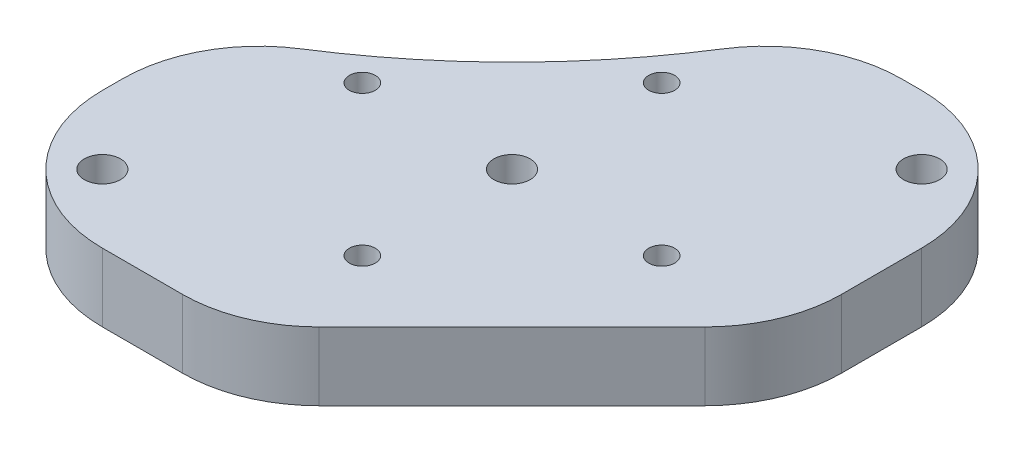
from build123d import *

# Parameters (mm, degrees)
EXTRUDE_4_OUTLINE_R   = 2.65
EXTRUDE_4_OUTLINE_R_2 = 1.9
EXTRUDE_4_DEPTH       = 10
FILLET_2_R            = 20


# Read off the part's stored shape, not the designer's step: 凸台-拉伸4
with BuildPart() as part:
    # 凸台-拉伸4 outline → 凸台-拉伸4 (new body)
    with BuildSketch(Plane(origin=(0, 0, 0), x_dir=(1, 0, 0), z_dir=(0, 1, 0))):
        with BuildLine():
            Line((85, -125), (125, -85))
            Line((125, -85), (125, -45))
            Line((125, -45), (90.421236444, -45))
            ThreePointArc((90.421236444, -45), (71.4177849, -71.4177849), (45, -90.421236444))
            Line((45, -90.421236444), (45, -125))
            Line((45, -125), (85, -125))
        make_face()
        with Locations((55, -115)):
            Circle(EXTRUDE_4_OUTLINE_R, mode=Mode.SUBTRACT)
        with Locations((85, -106.920310217)):
            Circle(EXTRUDE_4_OUTLINE_R_2, mode=Mode.SUBTRACT)
        with Locations((63.079689783, -85)):
            Circle(EXTRUDE_4_OUTLINE_R_2, mode=Mode.SUBTRACT)
        with Locations((85, -85)):
            Circle(EXTRUDE_4_OUTLINE_R, mode=Mode.SUBTRACT)
        with Locations((106.920310217, -85)):
            Circle(EXTRUDE_4_OUTLINE_R_2, mode=Mode.SUBTRACT)
        with Locations((85, -63.079689783)):
            Circle(EXTRUDE_4_OUTLINE_R_2, mode=Mode.SUBTRACT)
        with Locations((115, -55)):
            Circle(EXTRUDE_4_OUTLINE_R, mode=Mode.SUBTRACT)
    extrude(amount=EXTRUDE_4_DEPTH)

    # 圆角2
    fillet_2_edges = [part.edges().sort_by_distance(p)[0] for p in [
        (85, 5, 125),
        (45, 5, 125),
        (45, 5, 90.421236444),
        (90.421236444, 5, 45),
        (125, 5, 45),
        (125, 5, 85),
    ]]
    fillet(fillet_2_edges, radius=FILLET_2_R)


solid = part.part
